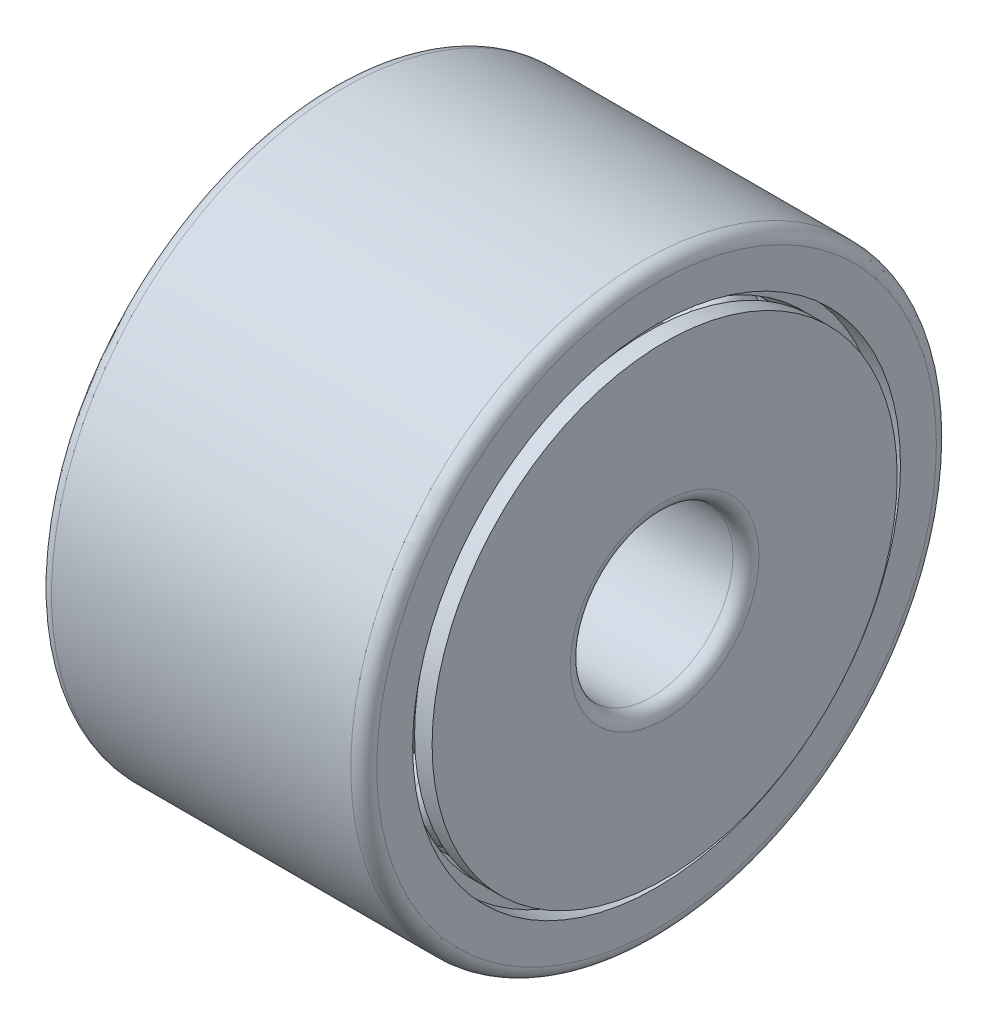
from build123d import *

# Parameters (mm, degrees)
ROLLERSDETAILED_COUNT = 12
ROLLERSDETAILED_ANGLE = 330


with BuildPart() as part:
    # OutRacSke → OuterRace (revolve)
    with BuildSketch(Plane.XY):
        with BuildLine():
            Line((-14.022916667, 22.6933125), (-14.022916667, 23.802578125))
            Line((-14.022916667, 23.802578125), (-15.875, 23.802578125))
            Line((-15.875, 23.802578125), (-15.875, 27.305))
            ThreePointArc((-15.875, 27.305), (-15.503025612, 28.203025612), (-14.605, 28.575))
            Line((-14.605, 28.575), (14.605, 28.575))
            ThreePointArc((14.605, 28.575), (15.503025612, 28.203025612), (15.875, 27.305))
            Line((15.875, 27.305), (15.875, 23.802578125))
            Line((15.875, 23.802578125), (14.022916667, 23.802578125))
            Line((14.022916667, 23.802578125), (14.022916667, 22.6933125))
            Line((14.022916667, 22.6933125), (-14.022916667, 22.6933125))
        make_face()
    revolve(axis=Axis((-7.9375, 0, 0), (1, 0, 0)))

    # RolDetSke → RollerDetailed (revolve)
    with BuildSketch(Plane.XY):
        with BuildLine():
            Line((-14.022916667, 20.9261075), (-14.022916667, 18.25625))
            Line((-14.022916667, 18.25625), (14.022916667, 18.25625))
            Line((14.022916667, 18.25625), (14.022916667, 20.9261075))
            ThreePointArc((14.022916667, 20.9261075), (13.501594562, 22.184690395), (12.243011667, 22.7060125))
            Line((12.243011667, 22.7060125), (-12.243011667, 22.7060125))
            ThreePointArc((-12.243011667, 22.7060125), (-13.501594562, 22.184690395), (-14.022916667, 20.9261075))
        make_face()
    rollerdetailed = revolve(axis=Axis((-28.575, 18.25625, 0), (1, 0, 0)))

    # RollersDetailed: RollerDetailed ×12 about axis
    rollersdetailed_axis = Axis((-50, 0, 0), (1, 0, 0))
    for i in range(1, ROLLERSDETAILED_COUNT):
        add(rollerdetailed.rotate(rollersdetailed_axis, i * ROLLERSDETAILED_ANGLE / (ROLLERSDETAILED_COUNT - 1)))

    # InsRacSke → InnerRace (revolve)
    with BuildSketch(Plane.XY):
        with BuildLine():
            Line((-14.948958333, 13.8191875), (-14.948958333, 22.6933125))
            Line((-14.948958333, 22.6933125), (-16.6624, 22.6933125))
            Line((-16.6624, 22.6933125), (-16.6624, 9.2075))
            ThreePointArc((-16.6624, 9.2075), (-16.290425612, 8.309474388), (-15.3924, 7.9375))
            Line((-15.3924, 7.9375), (-0.840026041, 7.9375))
            ThreePointArc((-0.840026041, 7.9375), (0, 8.255), (0.840026041, 7.9375))
            Line((0.840026041, 7.9375), (15.3924, 7.9375))
            ThreePointArc((15.3924, 7.9375), (16.290425612, 8.309474388), (16.6624, 9.2075))
            Line((16.6624, 9.2075), (16.6624, 22.6933125))
            Line((16.6624, 22.6933125), (14.948958333, 22.6933125))
            Line((14.948958333, 22.6933125), (14.948958333, 13.8191875))
            Line((14.948958333, 13.8191875), (-14.948958333, 13.8191875))
        make_face()
    revolve(axis=Axis((-7.9375, 0, 0), (1, 0, 0)))


solid = part.part
